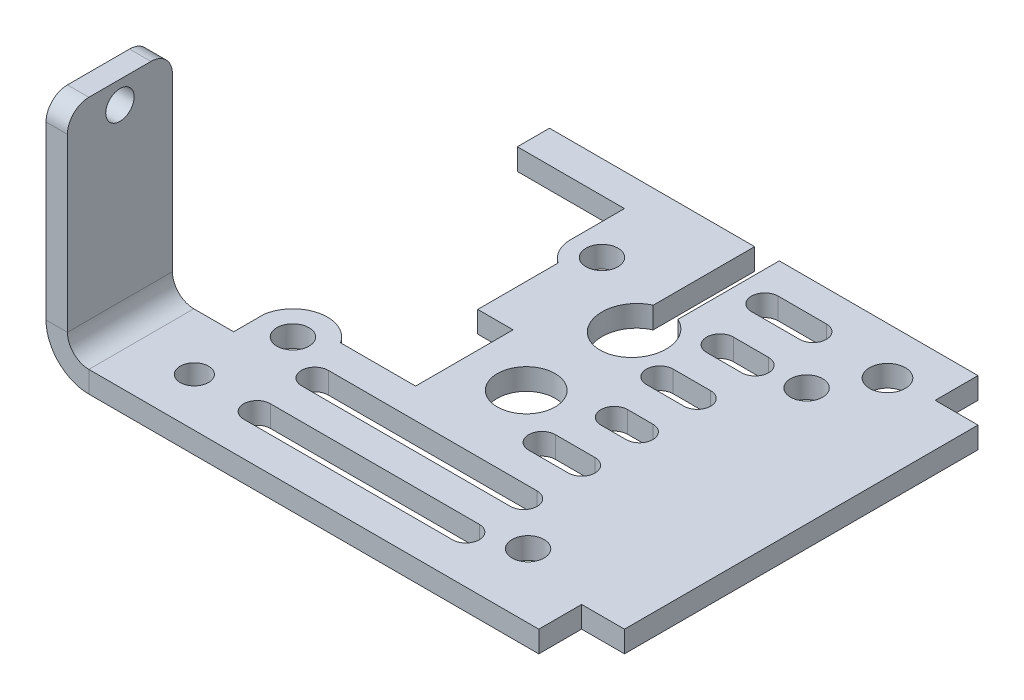
from build123d import *

# Parameters (mm, degrees)
SM_BASE_FLANGE_1_DEPTH   = 41
SKETCH_6_W               = 4
SKETCH_6_H               = 4
CUT_EXTRUDE_1_DEPTH      = 10
SKETCH_7_R               = 1.5
SKETCH_7_R_2             = 1.675
CUT_EXTRUDE_2_DEPTH      = 68.683085036
CUT_EXTRUDE_3_DEPTH      = 10
SKETCH_9_R               = 1.325
SKETCH_9_R_2             = 1.5
CUT_EXTRUDE_4_DEPTH      = 10
CUT_EXTRUDE_5_DEPTH      = 68.683085036
CUT_EXTRUDE_5_DEPTH_BACK = 68.683085036
SKETCH_10_W              = 7.72
SKETCH_10_H              = 10
CUT_EXTRUDE_6_DEPTH      = 68.683085036
CUT_EXTRUDE_6_DEPTH_BACK = 68.683085036
SKETCH_11_W              = 6
SKETCH_11_H              = 21.2
CUT_EXTRUDE_7_DEPTH      = 10
SKETCH_14_RX             = 3.175
SKETCH_14_RY             = 3
CUT_EXTRUDE_8_DEPTH      = 10
SKETCH_15_W              = 2.3
SKETCH_15_H              = 10
CUT_EXTRUDE_9_DEPTH      = 10
SKETCH_16_R              = 2.7
CUT_EXTRUDE_10_DEPTH     = 10
FILLET_1_R               = 2
SKETCH_17_R              = 1.325
CUT_EXTRUDE_11_DEPTH     = 10


# Sheet-metal steps are written as plain solids
with BuildPart() as part:
    # Sketch 1 → Базовая кромка1 (new body)
    with BuildSketch(Plane.XY):
        with BuildLine():
            Line((0, 22), (0, 4))
            ThreePointArc((0, 4), (1.171572875, 1.171572875), (4, 0))
            Line((4, 0), (50, 0))
            Line((50, 0), (50, 2))
            Line((50, 2), (4, 2))
            ThreePointArc((4, 2), (2.585786438, 2.585786438), (2, 4))
            Line((2, 4), (2, 22))
            Line((2, 22), (0, 22))
        make_face()
    extrude(amount=SM_BASE_FLANGE_1_DEPTH)

    # Эскиз6 → Вырез-Вытянуть1 (cut)
    with BuildSketch(Plane(origin=(0, 2, 0), x_dir=(1, 0, 0), z_dir=(0, 1, 0))):
        with Locations((48, -39)):
            Rectangle(SKETCH_6_W, SKETCH_6_H)
        with Locations((48, -2)):
            Rectangle(SKETCH_6_W, SKETCH_6_H)
    extrude(amount=-CUT_EXTRUDE_1_DEPTH, mode=Mode.SUBTRACT)

    # Эскиз7 → Вырез-Вытянуть2 (cut, through all)
    with BuildSketch(Plane(origin=(0, 2, 0), x_dir=(1, 0, 0), z_dir=(0, 1, 0))):
        with Locations(Location((39, -35, 0), (0, 0, 270))):
            Circle(SKETCH_7_R)
        with Locations(Location((39, -9, 0), (0, 0, 270))):
            Circle(SKETCH_7_R)
        with Locations(Location((41.975, -4.425, 0), (0, 0, 270))):
            Circle(SKETCH_7_R_2)
    extrude(amount=-CUT_EXTRUDE_2_DEPTH, mode=Mode.SUBTRACT)

    # Эскиз8 → Вырез-Вытянуть3 (cut)
    with BuildSketch(Plane(origin=(0, 2, 0), x_dir=(1, 0, 0), z_dir=(0, 1, 0))):
        with BuildLine():
            Line((34.75, -5.4), (30.25, -5.4))
            ThreePointArc((30.25, -5.4), (29, -4.15), (30.25, -2.9))
            Line((30.25, -2.9), (34.75, -2.9))
            ThreePointArc((34.75, -2.9), (36, -4.15), (34.75, -5.4))
        make_face()
        with BuildLine():
            Line((31.47, -8.3), (34.75, -8.3))
            ThreePointArc((34.75, -8.3), (36, -9.55), (34.75, -10.8))
            Line((34.75, -10.8), (31.47, -10.8))
            ThreePointArc((31.47, -10.8), (30.22, -9.55), (31.47, -8.3))
        make_face()
        with BuildLine():
            Line((31.25, -13.7), (34.75, -13.7))
            ThreePointArc((34.75, -13.7), (36, -14.95), (34.75, -16.2))
            Line((34.75, -16.2), (31.25, -16.2))
            ThreePointArc((31.25, -16.2), (30, -14.95), (31.25, -13.7))
        make_face()
        with BuildLine():
            Line((32.4, -19.1), (34.75, -19.1))
            ThreePointArc((34.75, -19.1), (36, -20.35), (34.75, -21.6))
            Line((34.75, -21.6), (32.4, -21.6))
            ThreePointArc((32.4, -21.6), (31.15, -20.35), (32.4, -19.1))
        make_face()
        with BuildLine():
            Line((31.05, -24.5), (34.75, -24.5))
            ThreePointArc((34.75, -24.5), (36, -25.75), (34.75, -27))
            Line((34.75, -27), (31.05, -27))
            ThreePointArc((31.05, -27), (29.8, -25.75), (31.05, -24.5))
        make_face()
        with BuildLine():
            Line((34.75, -32.4), (15.25, -32.4))
            ThreePointArc((15.25, -32.4), (14, -31.15), (15.25, -29.9))
            Line((15.25, -29.9), (34.75, -29.9))
            ThreePointArc((34.75, -29.9), (36, -31.15), (34.75, -32.4))
        make_face()
        with BuildLine():
            Line((15.25, -35.3), (34.75, -35.3))
            ThreePointArc((34.75, -35.3), (36, -36.55), (34.75, -37.8))
            Line((34.75, -37.8), (15.25, -37.8))
            ThreePointArc((15.25, -37.8), (14, -36.55), (15.25, -35.3))
        make_face()
    extrude(amount=-CUT_EXTRUDE_3_DEPTH, mode=Mode.SUBTRACT)

    # Эскиз9 → Вырез-Вытянуть4 (cut)
    with BuildSketch(Plane(origin=(0, 2, 0), x_dir=(1, 0, 0), z_dir=(0, 1, 0))):
        with Locations(Location((9.325, -36.475, 0), (0, 0, 270))):
            Circle(SKETCH_9_R)
        with Locations(Location((10.9, -28.85, 0), (0, 0, 270))):
            Circle(SKETCH_9_R_2)
        with Locations(Location((18.9, -8, 0), (0, 0, 270))):
            Circle(SKETCH_9_R_2)
    extrude(amount=-CUT_EXTRUDE_4_DEPTH, mode=Mode.SUBTRACT)

    # Эскиз10 → Вырез-Вытянуть5 (cut, two sides: drawn at the far end of the back side and taken through both)
    with BuildSketch(Plane(origin=(0, 2, 0), x_dir=(1, 0, 0), z_dir=(0, 1, 0)).offset(-CUT_EXTRUDE_5_DEPTH_BACK)):
        with Locations((3.86, -26.2)):
            Rectangle(SKETCH_10_W, SKETCH_10_H)
    extrude(amount=CUT_EXTRUDE_5_DEPTH + CUT_EXTRUDE_5_DEPTH_BACK, mode=Mode.SUBTRACT)

    # Эскиз11 → Вырез-Вытянуть6 (cut, two sides: drawn at the far end of the back side and taken through both)
    with BuildSketch(Plane(origin=(0, 2, 0), x_dir=(1, 0, 0), z_dir=(0, 1, 0)).offset(-CUT_EXTRUDE_6_DEPTH_BACK)):
        with Locations((3, -10.6)):
            Rectangle(SKETCH_11_W, SKETCH_11_H)
    extrude(amount=CUT_EXTRUDE_6_DEPTH + CUT_EXTRUDE_6_DEPTH_BACK, mode=Mode.SUBTRACT)

    # Эскиз12 → Вырез-Вытянуть7 (cut)
    with BuildSketch(Plane(origin=(0, 2, 0), x_dir=(1, 0, 0), z_dir=(0, 1, 0))):
        with BuildLine():
            Line((6, -3), (16, -3))
            Line((16, -3), (16, -8.028158581))
            ThreePointArc((16, -8.028158581), (16.344816391, -9.424582586), (17.3, -10.5))
            Line((17.3, -10.5), (17.3, -18))
            Line((17.3, -18), (20.6, -18))
            Line((20.6, -18), (20.6, -27.1))
            Line((20.6, -27.1), (13.6, -27.1))
            ThreePointArc((13.6, -27.1), (10.225833848, -25.703891292), (7.72, -28.36))
            Line((7.72, -28.36), (0.805596241, -28.36))
            Line((0.805596241, -28.36), (0.805596241, -3))
            Line((0.805596241, -3), (6, -3))
        make_face()
    extrude(amount=-CUT_EXTRUDE_7_DEPTH, mode=Mode.SUBTRACT)

    # Эскиз14 → Вырез-Вытянуть8 (cut)
    with BuildSketch(Plane(origin=(0, 2, 0), x_dir=(1, 0, 0), z_dir=(0, 1, 0))):
        with Locations(Location((26.3, -12.405), (0, 0, -90))):
            Ellipse(SKETCH_14_RX, SKETCH_14_RY)
    extrude(amount=-CUT_EXTRUDE_8_DEPTH, mode=Mode.SUBTRACT)

    # Эскиз15 → Вырез-Вытянуть9 (cut)
    with BuildSketch(Plane(origin=(0, 2, 0), x_dir=(1, 0, 0), z_dir=(0, 1, 0))):
        with Locations((26.3, -5)):
            Rectangle(SKETCH_15_W, SKETCH_15_H)
    extrude(amount=-CUT_EXTRUDE_9_DEPTH, mode=Mode.SUBTRACT)

    # Эскиз16 → Вырез-Вытянуть10 (cut)
    with BuildSketch(Plane(origin=(0, 2, 0), x_dir=(1, 0, 0), z_dir=(0, 1, 0))):
        with Locations(Location((26.1, -22.272936587, 0), (0, 0, 270))):
            Circle(SKETCH_16_R)
    extrude(amount=-CUT_EXTRUDE_10_DEPTH, mode=Mode.SUBTRACT)

    # Скругление1
    fillet_1_edges = [part.edges().sort_by_distance(p)[0] for p in [
        (1, 22, 31.2),
        (1, 22, 41),
    ]]
    fillet(fillet_1_edges, radius=FILLET_1_R)

    # Эскиз17 → Вырез-Вытянуть11 (cut)
    with BuildSketch(Plane.ZY):
        with Locations((36.1, 19.925)):
            Circle(SKETCH_17_R)
    extrude(amount=-CUT_EXTRUDE_11_DEPTH, mode=Mode.SUBTRACT)


solid = part.part
